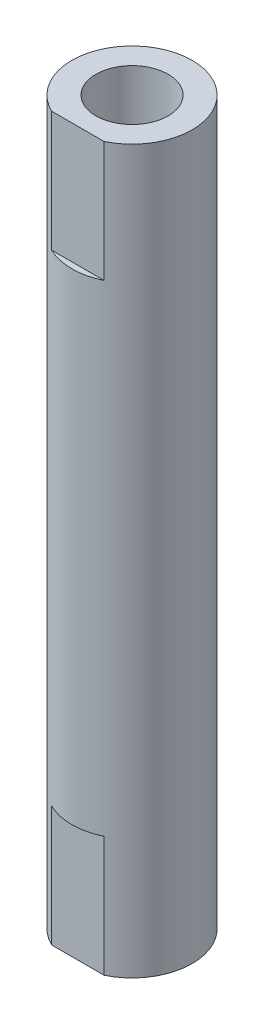
from build123d import *

# Parameters (mm, degrees)
SKETCH1_R           = 5
SKETCH1_R_2         = 3
BOSS_EXTRUDE1_DEPTH = 30
CUT_EXTRUDE1_START  = -10
CUT_EXTRUDE1_DEPTH  = 10


with BuildPart() as part:
    # Sketch1 → Boss-Extrude1 (new, symmetric)
    with BuildSketch(Plane(origin=(0, 0, 0), x_dir=(1, 0, 0), z_dir=(0, 1, 0))):
        Circle(SKETCH1_R)
        Circle(SKETCH1_R_2, mode=Mode.SUBTRACT)
    extrude(amount=BOSS_EXTRUDE1_DEPTH, both=True)

    # Sketch2 → Cut-Extrude1 (cut)
    with BuildSketch(Plane.XZ.offset(30).offset(CUT_EXTRUDE1_START)):
        with BuildLine():
            Line((-2.179449472, 4.5), (2.179449472, 4.5))
            ThreePointArc((2.179449472, 4.5), (0, 5), (-2.179449472, 4.5))
        make_face()
    cut_extrude1 = extrude(amount=CUT_EXTRUDE1_DEPTH, mode=Mode.SUBTRACT)

    # Mirror1: Cut-Extrude1 across plane
    add(cut_extrude1.mirror(Plane.ZX), mode=Mode.SUBTRACT)


solid = part.part
